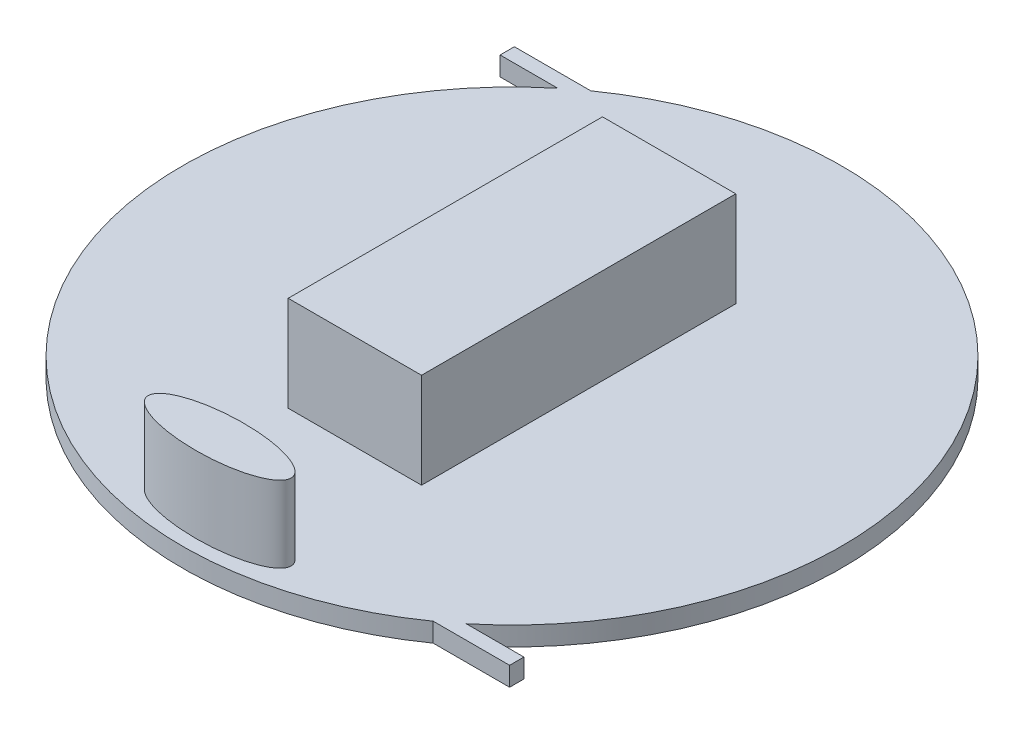
from build123d import *

# Parameters (mm, degrees)
BOSS_EXTRUDE1_DEPTH     = 2
SKETCH3_RX              = 7.5
SKETCH3_RY              = 2.5
BOSS_EXTRUDE2_DEPTH     = 8
CUT_EXTRUDE4_DEPTH      = 22
CUT_EXTRUDE4_DEPTH_BACK = 21
SKETCH1_6_W             = 28
SKETCH1_6_H             = 1.5
EXTRUDE_THIN1_DEPTH     = 2
SKETCH8_W               = 14
SKETCH8_H               = 33
BOSS_EXTRUDE3_DEPTH     = 10


with BuildPart() as part:
    # Sketch1 → Boss-Extrude1 (new body)
    with BuildSketch(Plane(origin=(0, 0, 0), x_dir=(1, 0, 0), z_dir=(0, 1, 0))):
        with BuildLine():
            ThreePointArc((-20.997857034, 27.5), (-27.5, -20.997857034), (20.997857034, -27.5))
            ThreePointArc((20.997857034, -27.5), (27.5, 20.997857034), (-20.997857034, 27.5))
        make_face()
    extrude(amount=BOSS_EXTRUDE1_DEPTH)

    # Sketch3 → Boss-Extrude2 (add)
    with BuildSketch(Plane(origin=(0, 2, 0), x_dir=(1, 0, 0), z_dir=(0, 1, 0))):
        with Locations((0, -30.694699658)):
            Ellipse(SKETCH3_RX, SKETCH3_RY)
    extrude(amount=BOSS_EXTRUDE2_DEPTH)

    # Sketch7 → Cut-Extrude4 (cut, two sides: drawn at the far end of the back side and taken through both)
    with BuildSketch(Plane.XY.offset(-CUT_EXTRUDE4_DEPTH_BACK)):
        Polygon((-34.6, 1), (-29.75, 0), (-34.6, 0), align=None)
    extrude(amount=CUT_EXTRUDE4_DEPTH + CUT_EXTRUDE4_DEPTH_BACK, mode=Mode.SUBTRACT)

    # Sketch1<6> → Extrude-Thin1 (add)
    with BuildSketch(Plane(origin=(0, 0, 0), x_dir=(1, 0, 0), z_dir=(0, 1, 0))):
        with Locations((-14, 27.5)):
            Rectangle(SKETCH1_6_W, SKETCH1_6_H)
        with Locations((14, -27.5)):
            Rectangle(SKETCH1_6_W, SKETCH1_6_H)
    extrude(amount=EXTRUDE_THIN1_DEPTH)


with BuildPart() as body_2:
    # Sketch8 → Boss-Extrude3 (new body)
    with BuildSketch(Plane(origin=(0, 2, 0), x_dir=(1, 0, 0), z_dir=(0, 1, 0))):
        Rectangle(SKETCH8_W, SKETCH8_H)
    extrude(amount=BOSS_EXTRUDE3_DEPTH)


solid = Compound([part.part, body_2.part])
